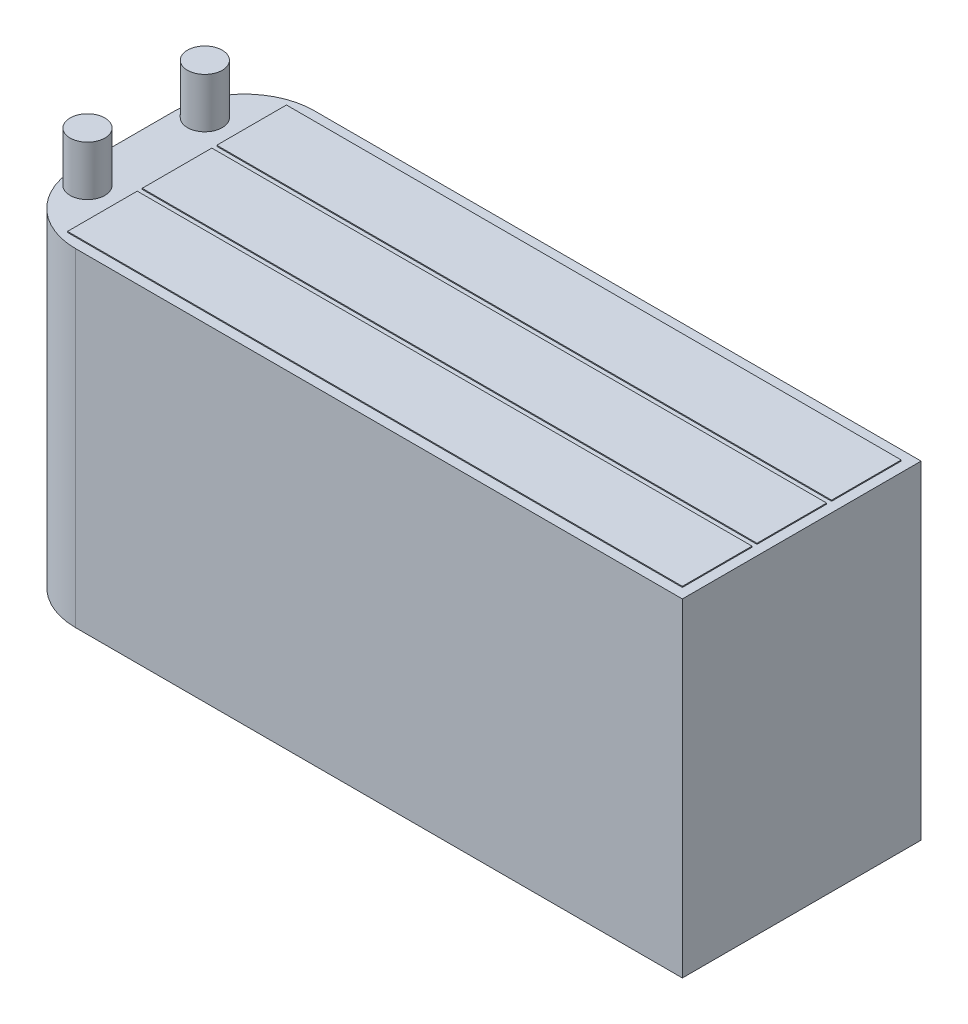
from build123d import *

# Parameters (mm, degrees)
SKETCH1_W             = 68
SKETCH1_H             = 33
BOSS_EXTRUDE1_DEPTH   = 24
FILLET1_R             = 7
SKETCH2_W             = 61.8
SKETCH2_H             = 7
BOSS_EXTRUDE2_DEPTH   = 0.1
BOSS_EXTRUDE2_2_DEPTH = 0.1
BOSS_EXTRUDE2_3_DEPTH = 0.1
SKETCH3_R             = 1.75
BOSS_EXTRUDE3_DEPTH   = 5


with BuildPart() as part:
    # Sketch1 → Boss-Extrude1 (new body)
    with BuildSketch(Plane.XY):
        Rectangle(SKETCH1_W, SKETCH1_H)
    extrude(amount=BOSS_EXTRUDE1_DEPTH)

    # Fillet1
    fillet1_edges = [part.edges().sort_by_distance(p)[0] for p in [
        (-34, 0, 0),
        (-34, 0, 24),
    ]]
    fillet(fillet1_edges, radius=FILLET1_R)

    # Sketch3 → Boss-Extrude3 (add)
    with BuildSketch(Plane(origin=(0, 16.5, 0), x_dir=(1, 0, 0), z_dir=(0, 1, 0))):
        with Locations((-31.9, -6.1)):
            Circle(SKETCH3_R)
        with Locations((-31.9, -17.9)):
            Circle(SKETCH3_R)
    extrude(amount=BOSS_EXTRUDE3_DEPTH)


with BuildPart() as body_2:
    # Sketch2 → Boss-Extrude2 (new body)
    with BuildSketch(Plane(origin=(0, 16.5, 0), x_dir=(1, 0, 0), z_dir=(0, 1, 0))):
        with Locations((2.1, -4.5)):
            Rectangle(SKETCH2_W, SKETCH2_H)
    extrude(amount=BOSS_EXTRUDE2_DEPTH)


with BuildPart() as body_3:
    # Sketch2 → Boss-Extrude2 2 (new body)
    with BuildSketch(Plane(origin=(0, 16.5, 0), x_dir=(1, 0, 0), z_dir=(0, 1, 0))):
        with Locations((2.1, -12)):
            Rectangle(SKETCH2_W, SKETCH2_H)
    extrude(amount=BOSS_EXTRUDE2_2_DEPTH)


with BuildPart() as body_4:
    # Sketch2 → Boss-Extrude2 3 (new body)
    with BuildSketch(Plane(origin=(0, 16.5, 0), x_dir=(1, 0, 0), z_dir=(0, 1, 0))):
        with Locations((2.1, -19.5)):
            Rectangle(SKETCH2_W, SKETCH2_H)
    extrude(amount=BOSS_EXTRUDE2_3_DEPTH)


with BuildPart() as body_5:
    # Mirror1: mirrored copy
    add(body_4.part.mirror(Plane.ZX))


with BuildPart() as body_6:
    # Mirror1 2: mirrored copy
    add(body_3.part.mirror(Plane.ZX))


with BuildPart() as body_7:
    # Mirror1 3: mirrored copy
    add(body_2.part.mirror(Plane.ZX))


solid = Compound([part.part, body_2.part, body_3.part, body_4.part, body_5.part, body_6.part, body_7.part])
